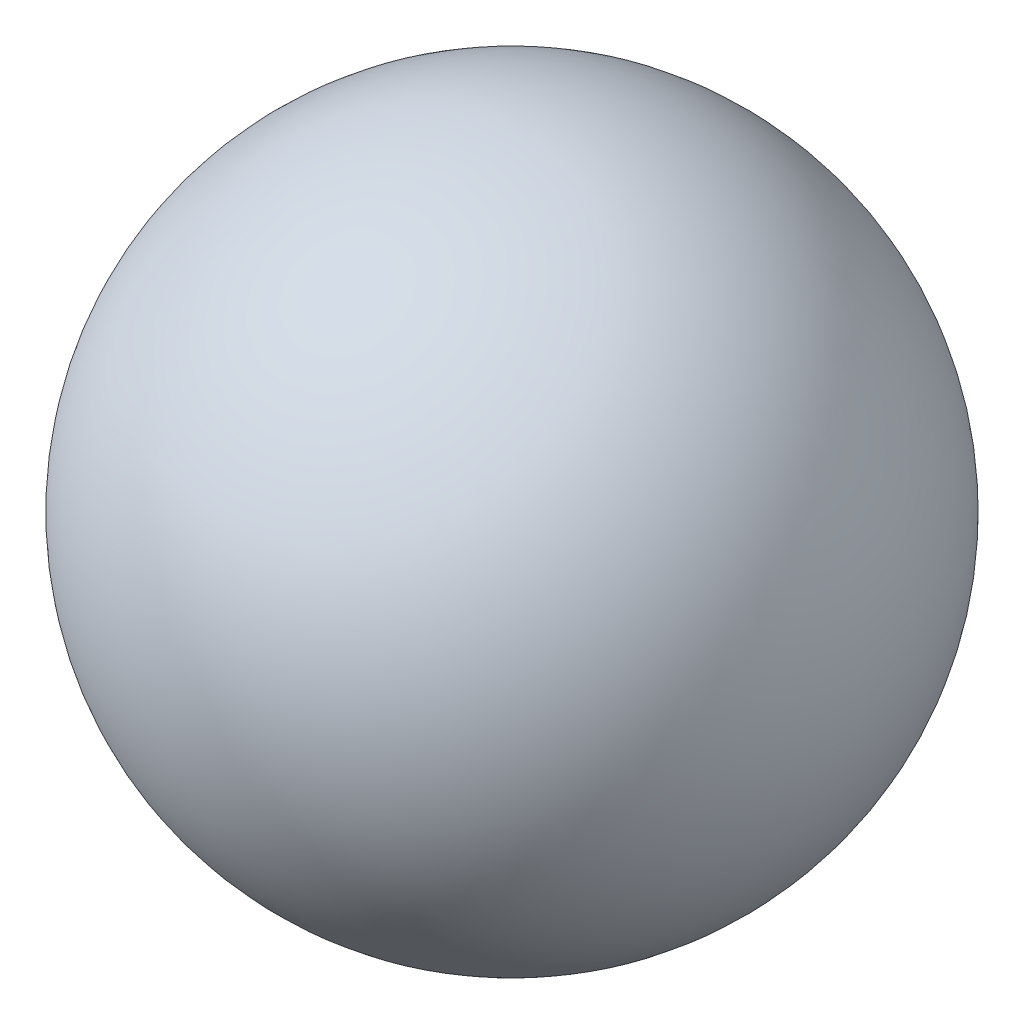
from build123d import *


with BuildPart() as part:
    # Sketch1 → Revolve3 (revolve)
    with BuildSketch(Plane.XY):
        with BuildLine():
            Line((0, 10.16), (0, -10.16))
            ThreePointArc((0, -10.16), (-10.16, 0), (0, 10.16))
        make_face()
    revolve(axis=Axis((0, 0, 0), (0, 1, 0)))


solid = part.part
